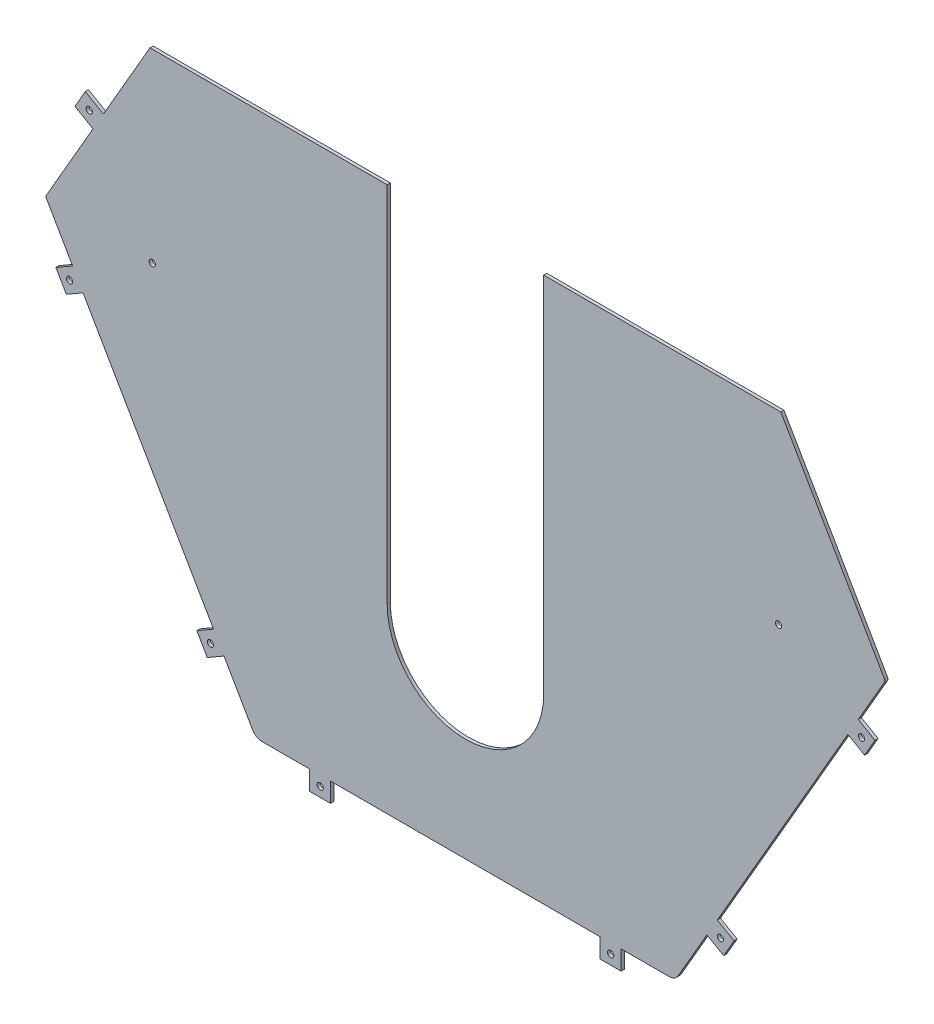
from build123d import *

# Parameters (mm, degrees)
SKETCH_1_R              = 3
EXTRUDE_1_DEPTH         = 1.5
SHEET_START             = -1.5
SHEET_METAL_1_OUTLINE_R = 3
SHEET_METAL_1_DEPTH     = 1.5


# Read off the part's stored shape, not the designer's step: Преобразовать-Твердое тело1
with BuildPart() as part:
    # Sketch 1 → Бобышка-Вытянуть1 (new body)
    with BuildSketch(Plane.XY):
        with BuildLine():
            Line((-75, -160), (-75, 187.455080757))
            Line((-75, 187.455080757), (-302.165063509, 187.455080757))
            Line((-302.165063509, 187.455080757), (-346.732050808, 110.262794416))
            Line((-346.732050808, 110.262794416), (-364.052558883, 120.262794416))
            Line((-364.052558883, 120.262794416), (-374.052558883, 102.942286341))
            Line((-374.052558883, 102.942286341), (-356.732050808, 92.942286341))
            Line((-356.732050808, 92.942286341), (-401.299038106, 15.75))
            ThreePointArc((-401.299038106, 15.75), (-401.700961894, 14.25), (-401.299038106, 12.75))
            Line((-401.299038106, 12.75), (-376.299038106, -30.551270189))
            Line((-376.299038106, -30.551270189), (-392.320508076, -39.801270189))
            Line((-392.320508076, -39.801270189), (-382.320508076, -57.121778265))
            Line((-382.320508076, -57.121778265), (-366.299038106, -47.871778265))
            Line((-366.299038106, -47.871778265), (-241.299038106, -264.378129211))
            Line((-241.299038106, -264.378129211), (-257.320508076, -273.628129211))
            Line((-257.320508076, -273.628129211), (-247.320508076, -290.948637287))
            Line((-247.320508076, -290.948637287), (-231.299038106, -281.698637287))
            Line((-231.299038106, -281.698637287), (-203.75277675, -329.410161514))
            ThreePointArc((-203.75277675, -329.410161514), (-200.092522712, -333.070415552), (-195.092522712, -334.410161514))
            Line((-195.092522712, -334.410161514), (-149.133974596, -334.410161514))
            Line((-149.133974596, -334.410161514), (-149.133974596, -352.910161514))
            Line((-149.133974596, -352.910161514), (-129.133974596, -352.910161514))
            Line((-129.133974596, -352.910161514), (-129.133974596, -334.410161514))
            Line((-129.133974596, -334.410161514), (129.133974596, -334.410161514))
            Line((129.133974596, -334.410161514), (129.133974596, -352.910161514))
            Line((129.133974596, -352.910161514), (149.133974596, -352.910161514))
            Line((149.133974596, -352.910161514), (149.133974596, -334.410161514))
            Line((149.133974596, -334.410161514), (195.092522712, -334.410161514))
            ThreePointArc((195.092522712, -334.410161514), (200.092522712, -333.070415552), (203.75277675, -329.410161514))
            Line((203.75277675, -329.410161514), (231.299038106, -281.698637287))
            Line((231.299038106, -281.698637287), (247.320508076, -290.948637287))
            Line((247.320508076, -290.948637287), (257.320508076, -273.628129211))
            Line((257.320508076, -273.628129211), (241.299038106, -264.378129211))
            Line((241.299038106, -264.378129211), (366.299038106, -47.871778265))
            Line((366.299038106, -47.871778265), (382.320508076, -57.121778265))
            Line((382.320508076, -57.121778265), (392.320508076, -39.801270189))
            Line((392.320508076, -39.801270189), (376.299038106, -30.551270189))
            Line((376.299038106, -30.551270189), (401.299038106, 12.75))
            ThreePointArc((401.299038106, 12.75), (401.700961894, 14.25), (401.299038106, 15.75))
            Line((401.299038106, 15.75), (302.165063509, 187.455080757))
            Line((302.165063509, 187.455080757), (75, 187.455080757))
            Line((75, 187.455080757), (75, -160))
            ThreePointArc((75, -160), (0, -235), (-75, -160))
        make_face()
        with Locations((244.309773091, -277.663383249)):
            Circle(SKETCH_1_R, mode=Mode.SUBTRACT)
        with Locations((139.133974596, -343.660161514)):
            Circle(SKETCH_1_R, mode=Mode.SUBTRACT)
        with Locations((-139.133974596, -343.660161514)):
            Circle(SKETCH_1_R, mode=Mode.SUBTRACT)
        with Locations((-244.309773091, -277.663383249)):
            Circle(SKETCH_1_R, mode=Mode.SUBTRACT)
        with Locations((300, 10)):
            Circle(SKETCH_1_R, mode=Mode.SUBTRACT)
        with Locations((-300, 10)):
            Circle(SKETCH_1_R, mode=Mode.SUBTRACT)
        with Locations((-379.309773091, -43.836524227)):
            Circle(SKETCH_1_R, mode=Mode.SUBTRACT)
        with Locations((379.309773091, -43.836524227)):
            Circle(SKETCH_1_R, mode=Mode.SUBTRACT)
        with Locations((-360.392304845, 106.602540378)):
            Circle(SKETCH_1_R, mode=Mode.SUBTRACT)
    extrude(amount=EXTRUDE_1_DEPTH)

    # Sheet Metal 1 outline → Sheet Metal 1 (add)
    with BuildSketch(Plane.XY.offset(SHEET_START)):
        with BuildLine():
            Line((-149.133974596, -334.410161514), (-149.133974596, -352.910161514))
            Line((-149.133974596, -352.910161514), (-129.133974596, -352.910161514))
            Line((-129.133974596, -352.910161514), (-129.133974596, -334.410161514))
            Line((-129.133974596, -334.410161514), (129.133974596, -334.410161514))
            Line((129.133974596, -334.410161514), (129.133974596, -352.910161514))
            Line((129.133974596, -352.910161514), (149.133974596, -352.910161514))
            Line((149.133974596, -352.910161514), (149.133974596, -334.410161514))
            Line((149.133974596, -334.410161514), (195.092522712, -334.410161514))
            ThreePointArc((195.092522712, -334.410161514), (200.092522712, -333.070415552), (203.75277675, -329.410161514))
            Line((203.75277675, -329.410161514), (231.299038106, -281.698637287))
            Line((231.299038106, -281.698637287), (247.320508076, -290.948637287))
            Line((247.320508076, -290.948637287), (257.320508076, -273.628129211))
            Line((257.320508076, -273.628129211), (241.299038106, -264.378129211))
            Line((241.299038106, -264.378129211), (366.299038106, -47.871778265))
            Line((366.299038106, -47.871778265), (382.320508076, -57.121778265))
            Line((382.320508076, -57.121778265), (392.320508076, -39.801270189))
            Line((392.320508076, -39.801270189), (376.299038106, -30.551270189))
            Line((376.299038106, -30.551270189), (401.299038106, 12.75))
            ThreePointArc((401.299038106, 12.75), (401.700961894, 14.25), (401.299038106, 15.75))
            Line((401.299038106, 15.75), (302.165063509, 187.455080757))
            Line((302.165063509, 187.455080757), (75, 187.455080757))
            Line((75, 187.455080757), (75, -160))
            ThreePointArc((75, -160), (0, -235), (-75, -160))
            Line((-75, -160), (-75, 187.455080757))
            Line((-75, 187.455080757), (-302.165063509, 187.455080757))
            Line((-302.165063509, 187.455080757), (-346.732050808, 110.262794416))
            Line((-346.732050808, 110.262794416), (-364.052558883, 120.262794416))
            Line((-364.052558883, 120.262794416), (-374.052558883, 102.942286341))
            Line((-374.052558883, 102.942286341), (-356.732050808, 92.942286341))
            Line((-356.732050808, 92.942286341), (-401.299038106, 15.75))
            ThreePointArc((-401.299038106, 15.75), (-401.700961894, 14.25), (-401.299038106, 12.75))
            Line((-401.299038106, 12.75), (-376.299038106, -30.551270189))
            Line((-376.299038106, -30.551270189), (-392.320508076, -39.801270189))
            Line((-392.320508076, -39.801270189), (-382.320508076, -57.121778265))
            Line((-382.320508076, -57.121778265), (-366.299038106, -47.871778265))
            Line((-366.299038106, -47.871778265), (-241.299038106, -264.378129211))
            Line((-241.299038106, -264.378129211), (-257.320508076, -273.628129211))
            Line((-257.320508076, -273.628129211), (-247.320508076, -290.948637287))
            Line((-247.320508076, -290.948637287), (-231.299038106, -281.698637287))
            Line((-231.299038106, -281.698637287), (-203.75277675, -329.410161514))
            ThreePointArc((-203.75277675, -329.410161514), (-200.092522712, -333.070415552), (-195.092522712, -334.410161514))
            Line((-195.092522712, -334.410161514), (-149.133974596, -334.410161514))
        make_face()
        with Locations((-244.309773091, -277.663383249)):
            Circle(SHEET_METAL_1_OUTLINE_R, mode=Mode.SUBTRACT)
        with Locations((-139.133974596, -343.660161514)):
            Circle(SHEET_METAL_1_OUTLINE_R, mode=Mode.SUBTRACT)
        with Locations((139.133974596, -343.660161514)):
            Circle(SHEET_METAL_1_OUTLINE_R, mode=Mode.SUBTRACT)
        with Locations((244.309773091, -277.663383249)):
            Circle(SHEET_METAL_1_OUTLINE_R, mode=Mode.SUBTRACT)
        with Locations((-379.309773091, -43.836524227)):
            Circle(SHEET_METAL_1_OUTLINE_R, mode=Mode.SUBTRACT)
        with Locations((-300, 10)):
            Circle(SHEET_METAL_1_OUTLINE_R, mode=Mode.SUBTRACT)
        with Locations((-360.392304845, 106.602540378)):
            Circle(SHEET_METAL_1_OUTLINE_R, mode=Mode.SUBTRACT)
        with Locations((379.309773091, -43.836524227)):
            Circle(SHEET_METAL_1_OUTLINE_R, mode=Mode.SUBTRACT)
        with Locations((300, 10)):
            Circle(SHEET_METAL_1_OUTLINE_R, mode=Mode.SUBTRACT)
    extrude(amount=SHEET_METAL_1_DEPTH)


solid = part.part
